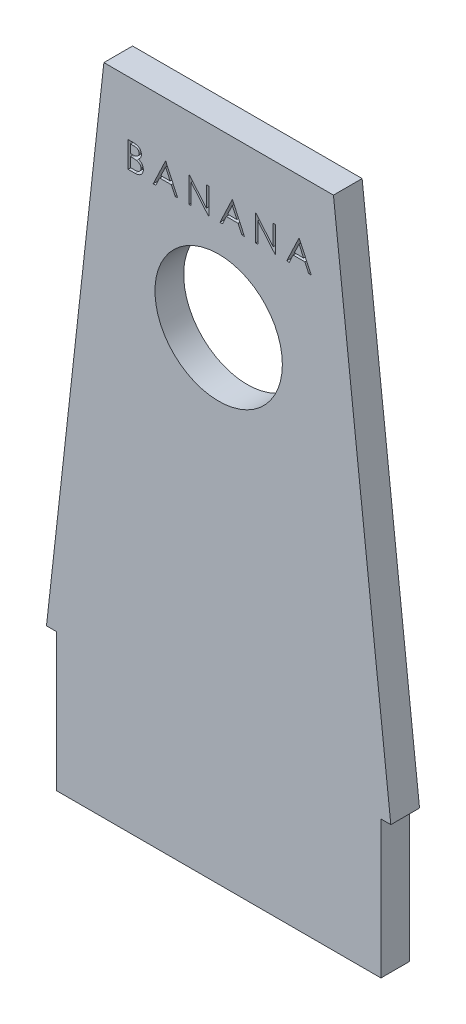
from build123d import *

# Parameters (mm, degrees)
SKETCH1_R           = 5.25
BOSS_EXTRUDE1_DEPTH = 5
SKETCH3_R           = 11.1
CUT_EXTRUDE1_DEPTH  = 6
WRAP1_START         = -4
WRAP1_DEPTH         = 4
SKETCH5_W           = 56.56
SKETCH5_H           = 5
BOSS_EXTRUDE2_DEPTH = 24


# Read off the part's stored shape, not the designer's step: Wrap1
with BuildPart() as part:
    # Sketch1 → Boss-Extrude1 (new body)
    with BuildSketch(Plane.XY):
        Polygon((-30, 0), (30, 0), (20, 90), (-20, 90), align=None)
        with Locations((0, 60)):
            Circle(SKETCH1_R, mode=Mode.SUBTRACT)
    extrude(amount=BOSS_EXTRUDE1_DEPTH)

    # Sketch3 → Cut-Extrude1 (cut)
    with BuildSketch(Plane.XY.offset(5)):
        with Locations((0, 60)):
            Circle(SKETCH3_R)
    extrude(amount=-CUT_EXTRUDE1_DEPTH, mode=Mode.SUBTRACT)

    # Wrap1 outline → Wrap1 (cut)
    # profile 1 of 6: a face of its own
    with BuildSketch(Plane.XY.offset(5).offset(WRAP1_START)):
        with BuildLine():
            add(Edge.make_bspline(
                [(-14.900841346, 80.5), (-14.857861874, 80.499774035), (-14.774556961, 80.499336059), (-14.653417679, 80.492543462), (-14.539954922, 80.483281601), (-14.434135786, 80.468585767), (-14.336009169, 80.450853482), (-14.245279349, 80.429379719), (-14.162234842, 80.403631216), (-14.063089895, 80.362685997), (-13.950049046, 80.301841923), (-13.827651112, 80.211933768), (-13.722988519, 80.101963458), (-13.632748968, 79.97791433), (-13.561004671, 79.841454052), (-13.509101289, 79.695835095), (-13.476241164, 79.542935713), (-13.472861748, 79.437965912), (-13.471153846, 79.384915865)],
                knots=[0, 0, 0, 0, 0.062594097, 0.121322939, 0.176680142, 0.228365096, 0.276868446, 0.321879128, 0.364098625, 0.403355696, 0.477967948, 0.550535461, 0.623584457, 0.698174882, 0.77335367, 0.847281125, 0.92281834, 1, 1, 1, 1], degree=3))
            Line((-14.900841346, 80.5), (-15.778846154, 80.5))
            Line((-15.778846154, 80.5), (-15.778846154, 76))
            Line((-15.778846154, 76), (-14.561899038, 76))
            add(Edge.make_bspline(
                [(-13.125, 77.27734375), (-13.126255945, 77.233414914), (-13.128727052, 77.1469837), (-13.146958444, 77.020012812), (-13.177827296, 76.898673595), (-13.220347341, 76.782181218), (-13.275841746, 76.670761045), (-13.3433777, 76.564286848), (-13.423903996, 76.463828423), (-13.513984827, 76.368269479), (-13.6158933, 76.282348038), (-13.725842128, 76.205827844), (-13.845215968, 76.142897193), (-13.972054246, 76.090033736), (-14.107779795, 76.049653053), (-14.251783147, 76.021402601), (-14.403940107, 76.002367553), (-14.508352644, 76.000802575), (-14.561899038, 76)],
                knots=[0, 0, 0, 0, 0.061160277, 0.120334558, 0.178180255, 0.235235126, 0.292682961, 0.351186248, 0.41045661, 0.471719854, 0.533761203, 0.595739024, 0.657887515, 0.72129518, 0.786822515, 0.854686154, 0.925477986, 1, 1, 1, 1], degree=3))
            add(Edge.make_bspline(
                [(-13.991286058, 78.427584135), (-13.940165508, 78.407957707), (-13.842359233, 78.37040749), (-13.707762931, 78.304019037), (-13.59179813, 78.231810609), (-13.493573228, 78.152955373), (-13.409567672, 78.067958331), (-13.33621389, 77.975573184), (-13.273623552, 77.874594781), (-13.21999265, 77.76607595), (-13.178144249, 77.651124776), (-13.146803801, 77.530819492), (-13.128845652, 77.405591493), (-13.126290113, 77.320367434), (-13.125, 77.27734375)],
                knots=[0, 0, 0, 0, 0.106057493, 0.202914257, 0.290300165, 0.370222566, 0.446383721, 0.5213969, 0.598291083, 0.676142469, 0.7555287, 0.834887172, 0.916646049, 1, 1, 1, 1], degree=3))
            add(Edge.make_bspline(
                [(-13.471153846, 79.384915865), (-13.472559413, 79.335219722), (-13.475321484, 79.237562115), (-13.501733603, 79.094726831), (-13.543083034, 78.958760979), (-13.600561211, 78.830160769), (-13.675263778, 78.711831838), (-13.763795902, 78.602819638), (-13.870608933, 78.507739708), (-13.950635956, 78.454584548), (-13.991286058, 78.427584135)],
                knots=[0, 0, 0, 0, 0.130569107, 0.256580609, 0.380551617, 0.503622917, 0.625739323, 0.747548582, 0.871766119, 1, 1, 1, 1], degree=3))
        make_face()
        with BuildLine():
            add(Edge.make_bspline(
                [(-14.799879808, 76.461538462), (-14.758712617, 76.462031851), (-14.679368285, 76.462982794), (-14.56480956, 76.466087222), (-14.458631284, 76.473148719), (-14.361317967, 76.484264811), (-14.271818813, 76.496322817), (-14.191207481, 76.512537321), (-14.118830518, 76.531114556), (-14.034906408, 76.559829921), (-13.940401897, 76.604439669), (-13.838559368, 76.671700817), (-13.748011373, 76.751830784), (-13.671118897, 76.844570531), (-13.608102197, 76.945410809), (-13.562259469, 77.052311973), (-13.533985511, 77.163507651), (-13.530562721, 77.239321996), (-13.528846154, 77.27734375)],
                knots=[0, 0, 0, 0, 0.072502489, 0.139738989, 0.201795135, 0.259821934, 0.312205989, 0.360773434, 0.404540343, 0.443698099, 0.516840794, 0.587874336, 0.657965418, 0.728969389, 0.79930772, 0.866635778, 0.933116329, 1, 1, 1, 1], degree=3))
            Line((-14.799879808, 76.461538462), (-15.375, 76.461538462))
            Line((-15.375, 76.461538462), (-15.375, 78.134615385))
            Line((-15.375, 78.134615385), (-15.107271635, 78.134615385))
            add(Edge.make_bspline(
                [(-14.265324519, 78.081430288), (-14.287219071, 78.085872539), (-14.334690975, 78.095504255), (-14.412100722, 78.105671303), (-14.50047541, 78.114729237), (-14.60001911, 78.121429297), (-14.710857762, 78.128354852), (-14.833228087, 78.131048194), (-14.966630348, 78.134261528), (-15.05919197, 78.134494415), (-15.107271635, 78.134615385)],
                knots=[0, 0, 0, 0, 0.079306486, 0.171952819, 0.277056507, 0.394730576, 0.526177321, 0.671344767, 0.829285257, 1, 1, 1, 1], degree=3))
            add(Edge.make_bspline(
                [(-13.528846154, 77.27734375), (-13.529201145, 77.301120902), (-13.529905402, 77.348291679), (-13.540526192, 77.417612018), (-13.555972596, 77.484759569), (-13.575941583, 77.549916664), (-13.605023755, 77.611905291), (-13.638975027, 77.671951439), (-13.678782543, 77.730134484), (-13.740810757, 77.803693095), (-13.831031879, 77.88844354), (-13.959226305, 77.971420329), (-14.104990688, 78.038338938), (-14.21071175, 78.066752551), (-14.265324519, 78.081430288)],
                knots=[0, 0, 0, 0, 0.060287398, 0.119602355, 0.177503371, 0.235142664, 0.292132593, 0.350871209, 0.410097863, 0.470731522, 0.594828704, 0.722578824, 0.85669139, 1, 1, 1, 1], degree=3))
        make_face(mode=Mode.SUBTRACT)
        with BuildLine():
            add(Edge.make_bspline(
                [(-15.103665865, 78.596153846), (-15.064003128, 78.596668033), (-14.987366638, 78.597661546), (-14.876383914, 78.600507497), (-14.773366033, 78.60847641), (-14.678490819, 78.616443033), (-14.591907677, 78.629396074), (-14.513808427, 78.644814518), (-14.442967373, 78.66112111), (-14.361273672, 78.688853307), (-14.268608453, 78.72983889), (-14.169823033, 78.793445536), (-14.082735858, 78.869205419), (-14.009196616, 78.95662237), (-13.94901044, 79.052878894), (-13.907207092, 79.156439169), (-13.878860584, 79.264722196), (-13.876300043, 79.33905995), (-13.875, 79.376802885)],
                knots=[0, 0, 0, 0, 0.072301034, 0.139700332, 0.202288511, 0.260599533, 0.313190329, 0.361738933, 0.405706476, 0.445539985, 0.518831956, 0.58977824, 0.658867479, 0.728430478, 0.797282704, 0.864815377, 0.931363753, 1, 1, 1, 1], degree=3))
            Line((-15.103665865, 78.596153846), (-15.375, 78.596153846))
            Line((-15.375, 78.596153846), (-15.375, 80.038461538))
            Line((-15.375, 80.038461538), (-14.826923077, 80.038461538))
            add(Edge.make_bspline(
                [(-13.875, 79.376802885), (-13.875676517, 79.401778877), (-13.87700358, 79.450772012), (-13.887872112, 79.52219261), (-13.906344708, 79.589363149), (-13.930071656, 79.653204148), (-13.963228542, 79.711719384), (-14.00226728, 79.766932064), (-14.049434596, 79.816961931), (-14.10312257, 79.863722715), (-14.164847942, 79.905179965), (-14.234573889, 79.941489517), (-14.313243759, 79.970727659), (-14.399531715, 79.99633414), (-14.494765971, 80.01431909), (-14.59784754, 80.029302017), (-14.70962075, 80.036929828), (-14.786950167, 80.03793958), (-14.826923077, 80.038461538)],
                knots=[0, 0, 0, 0, 0.057003133, 0.111817869, 0.164402372, 0.215869805, 0.26684111, 0.317478963, 0.369902136, 0.423400449, 0.479718398, 0.539241497, 0.602430689, 0.671029546, 0.744484798, 0.823453971, 0.908740313, 1, 1, 1, 1], degree=3))
        make_face(mode=Mode.SUBTRACT)
    # profile 2 of 6: a face of its own
    with BuildSketch(Plane.XY.offset(5).offset(WRAP1_START)):
        Polygon((15.685997596, 76), (16.125, 76), (14.048076923, 80.5), (13.990384615, 80.5), (11.855769231, 76), (12.296574519, 76), (12.980769231, 77.442307692), (15.020733173, 77.442307692), align=None)
        Polygon((14.807992788, 77.903846154), (13.199819712, 77.903846154), (14.014723558, 79.622896635), align=None, mode=Mode.SUBTRACT)
    # profile 3 of 6: a face of its own
    with BuildSketch(Plane.XY.offset(5).offset(WRAP1_START)):
        Polygon((9.813822115, 76), (9.905769231, 76), (9.905769231, 80.5), (9.501923077, 80.5), (9.501923077, 76.958233173), (6.528966346, 80.5), (6.444230769, 80.5), (6.444230769, 76), (6.848076923, 76), (6.848076923, 79.533653846), align=None)
    # profile 4 of 6: a face of its own
    with BuildSketch(Plane.XY.offset(5).offset(WRAP1_START)):
        Polygon((4.055228365, 76), (4.494230769, 76), (2.417307692, 80.5), (2.359615385, 80.5), (0.225, 76), (0.665805288, 76), (1.35, 77.442307692), (3.389963942, 77.442307692), align=None)
        Polygon((3.177223558, 77.903846154), (1.569050481, 77.903846154), (2.383954327, 79.622896635), align=None, mode=Mode.SUBTRACT)
    # profile 5 of 6: a face of its own
    with BuildSketch(Plane.XY.offset(5).offset(WRAP1_START)):
        Polygon((-1.816947115, 76), (-1.725, 76), (-1.725, 80.5), (-2.128846154, 80.5), (-2.128846154, 76.958233173), (-5.101802885, 80.5), (-5.186538462, 80.5), (-5.186538462, 76), (-4.782692308, 76), (-4.782692308, 79.533653846), align=None)
    # profile 6 of 6: a face of its own
    with BuildSketch(Plane.XY.offset(5).offset(WRAP1_START)):
        Polygon((-7.575540865, 76), (-7.136538462, 76), (-9.213461538, 80.5), (-9.271153846, 80.5), (-11.405769231, 76), (-10.964963942, 76), (-10.280769231, 77.442307692), (-8.240805288, 77.442307692), align=None)
        Polygon((-8.453545673, 77.903846154), (-10.06171875, 77.903846154), (-9.246814904, 79.622896635), align=None, mode=Mode.SUBTRACT)
    extrude(amount=WRAP1_DEPTH, mode=Mode.SUBTRACT)

    # Sketch5 → Boss-Extrude2 (add)
    with BuildSketch(Plane.XZ):
        with Locations((0, 2.5)):
            Rectangle(SKETCH5_W, SKETCH5_H)
    extrude(amount=BOSS_EXTRUDE2_DEPTH)


solid = part.part
